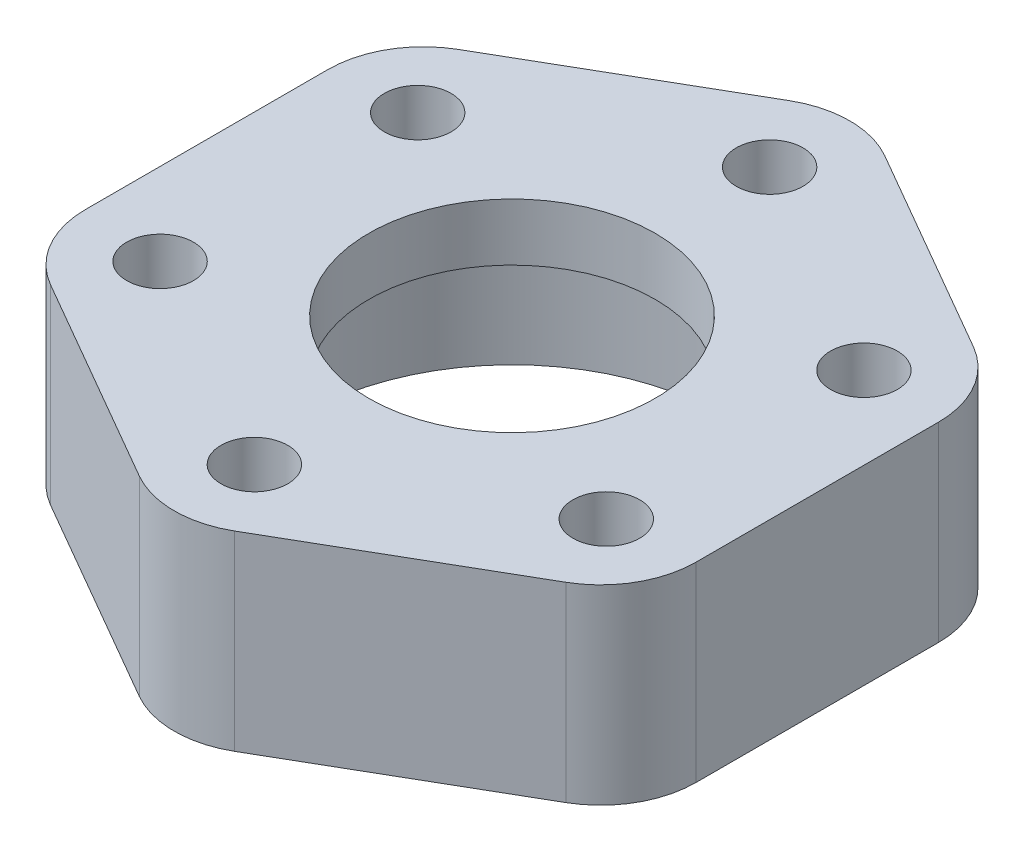
from build123d import *

# Parameters (mm, degrees)
SKETCH1_R           = 11
SKETCH1_R_2         = 1.75
BOSS_EXTRUDE1_DEPTH = 10
BOSS_EXTRUDE2_START = -3
SKETCH2_R           = 11
SKETCH2_R_2         = 7.5
BOSS_EXTRUDE2_DEPTH = 3


with BuildPart() as part:
    # Sketch1 → Boss-Extrude1 (new body)
    with BuildSketch(Plane(origin=(0, 0, 0), x_dir=(1, 0, 0), z_dir=(0, 1, 0))):
        with BuildLine():
            Line((-2.5, 17.031832941), (-13.5, 10.68097998))
            ThreePointArc((-13.5, 10.68097998), (-15.330127019, 8.850852961), (-16, 6.350852961))
            Line((-16, 6.350852961), (-16, -6.350852961))
            ThreePointArc((-16, -6.350852961), (-15.330127019, -8.850852961), (-13.5, -10.68097998))
            Line((-13.5, -10.68097998), (-2.5, -17.031832941))
            ThreePointArc((-2.5, -17.031832941), (0, -17.701705922), (2.5, -17.031832941))
            Line((2.5, -17.031832941), (13.5, -10.68097998))
            ThreePointArc((13.5, -10.68097998), (15.330127019, -8.850852961), (16, -6.350852961))
            Line((16, -6.350852961), (16, 6.350852961))
            ThreePointArc((16, 6.350852961), (15.330127019, 8.850852961), (13.5, 10.68097998))
            Line((13.5, 10.68097998), (2.5, 17.031832941))
            ThreePointArc((2.5, 17.031832941), (0, 17.701705922), (-2.5, 17.031832941))
        make_face()
        Circle(SKETCH1_R, mode=Mode.SUBTRACT)
        with Locations((0, 13.5)):
            Circle(SKETCH1_R_2, mode=Mode.SUBTRACT)
        with Locations((11.691342951, 6.75)):
            Circle(SKETCH1_R_2, mode=Mode.SUBTRACT)
        with Locations((11.691342951, -6.75)):
            Circle(SKETCH1_R_2, mode=Mode.SUBTRACT)
        with Locations((0, -13.5)):
            Circle(SKETCH1_R_2, mode=Mode.SUBTRACT)
        with Locations((-11.691342951, -6.75)):
            Circle(SKETCH1_R_2, mode=Mode.SUBTRACT)
        with Locations((-11.691342951, 6.75)):
            Circle(SKETCH1_R_2, mode=Mode.SUBTRACT)
    extrude(amount=BOSS_EXTRUDE1_DEPTH)

    # Sketch2 → Boss-Extrude2 (add)
    with BuildSketch(Plane(origin=(0, 10, 0), x_dir=(1, 0, 0), z_dir=(0, 1, 0)).offset(BOSS_EXTRUDE2_START)):
        Circle(SKETCH2_R)
        Circle(SKETCH2_R_2, mode=Mode.SUBTRACT)
    extrude(amount=BOSS_EXTRUDE2_DEPTH)


solid = part.part
